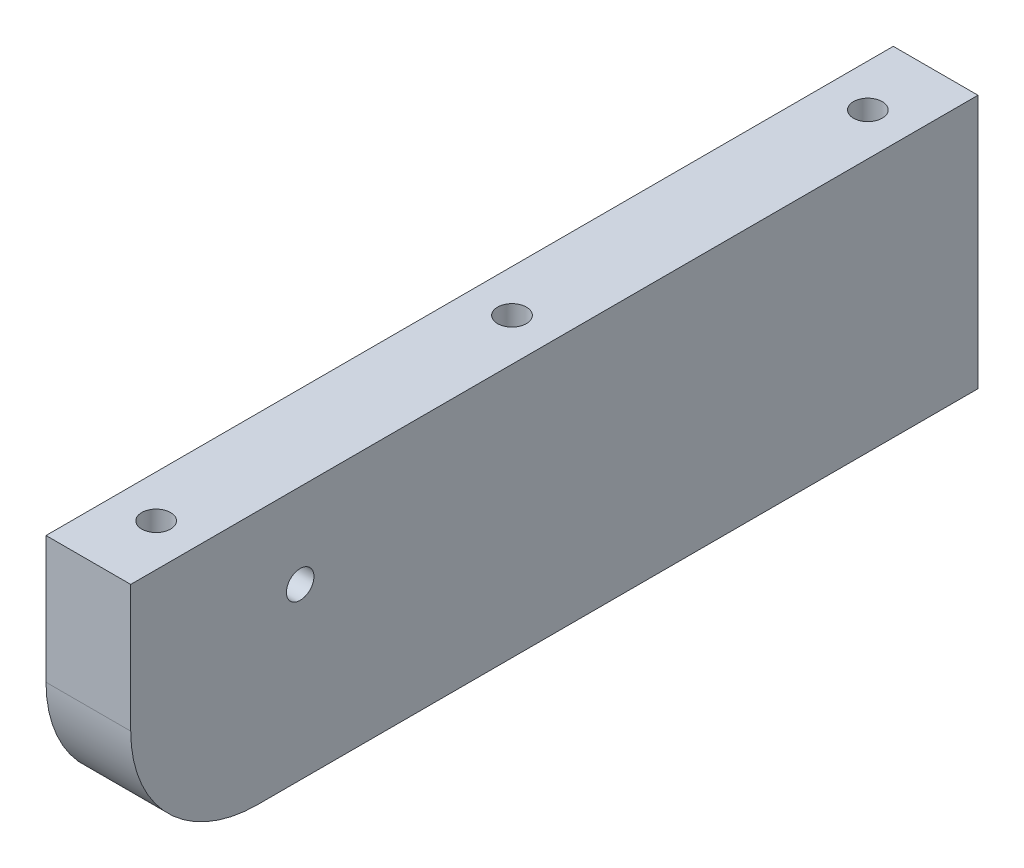
from build123d import *

# Parameters (mm, degrees)
SKETCH1_W                     = 100
SKETCH1_H                     = 30
SKETCH1_R                     = 1.625
BOSS_EXTRUDE1_DEPTH           = 10
FILLET1_R                     = 15
CBORE_FOR_M3_SHCS_D           = 3.4
CBORE_FOR_M3_SHCS_DEPTH       = 23
CBORE_FOR_M3_SHCS_CBORE_D     = 6.5
CBORE_FOR_M3_SHCS_CBORE_DEPTH = 3
CBORE_FOR_M3_SHCS_TIP         = 1.021463052


with BuildPart() as part:
    # Sketch1 → Boss-Extrude1 (new body)
    with BuildSketch(Plane(origin=(0, 0, 0), x_dir=(0, 0, -1), z_dir=(1, 0, 0))):
        Rectangle(SKETCH1_W, SKETCH1_H)
        with Locations((-30, 5)):
            Circle(SKETCH1_R, mode=Mode.SUBTRACT)
    extrude(amount=BOSS_EXTRUDE1_DEPTH)

    # Fillet1
    fillet1_edges = [part.edges().sort_by_distance(p)[0] for p in [
        (5, -15, 50),
    ]]
    fillet(fillet1_edges, radius=FILLET1_R)

    # CBORE for M3 SHCS
    with Locations(Plane(origin=(-616.293536786, 25, -1323.282701689), x_dir=(1, 0, 0), z_dir=(0, 1, 0))):
        with Locations((731.293536786, -1281.282701689), (731.293536786, -1359.282701689), (621.293536786, -1281.282701689), (621.293536786, -1365.282701689), (621.293536786, -1323.282701689), (731.293536786, -1320.282701689)):
            CounterBoreHole(CBORE_FOR_M3_SHCS_D / 2, CBORE_FOR_M3_SHCS_CBORE_D / 2, CBORE_FOR_M3_SHCS_CBORE_DEPTH, depth=CBORE_FOR_M3_SHCS_DEPTH)
            with Locations((0, 0, -(CBORE_FOR_M3_SHCS_DEPTH + CBORE_FOR_M3_SHCS_TIP / 2))):  # 118° drill point
                Cone(0, CBORE_FOR_M3_SHCS_D / 2, CBORE_FOR_M3_SHCS_TIP, mode=Mode.SUBTRACT)


solid = part.part
